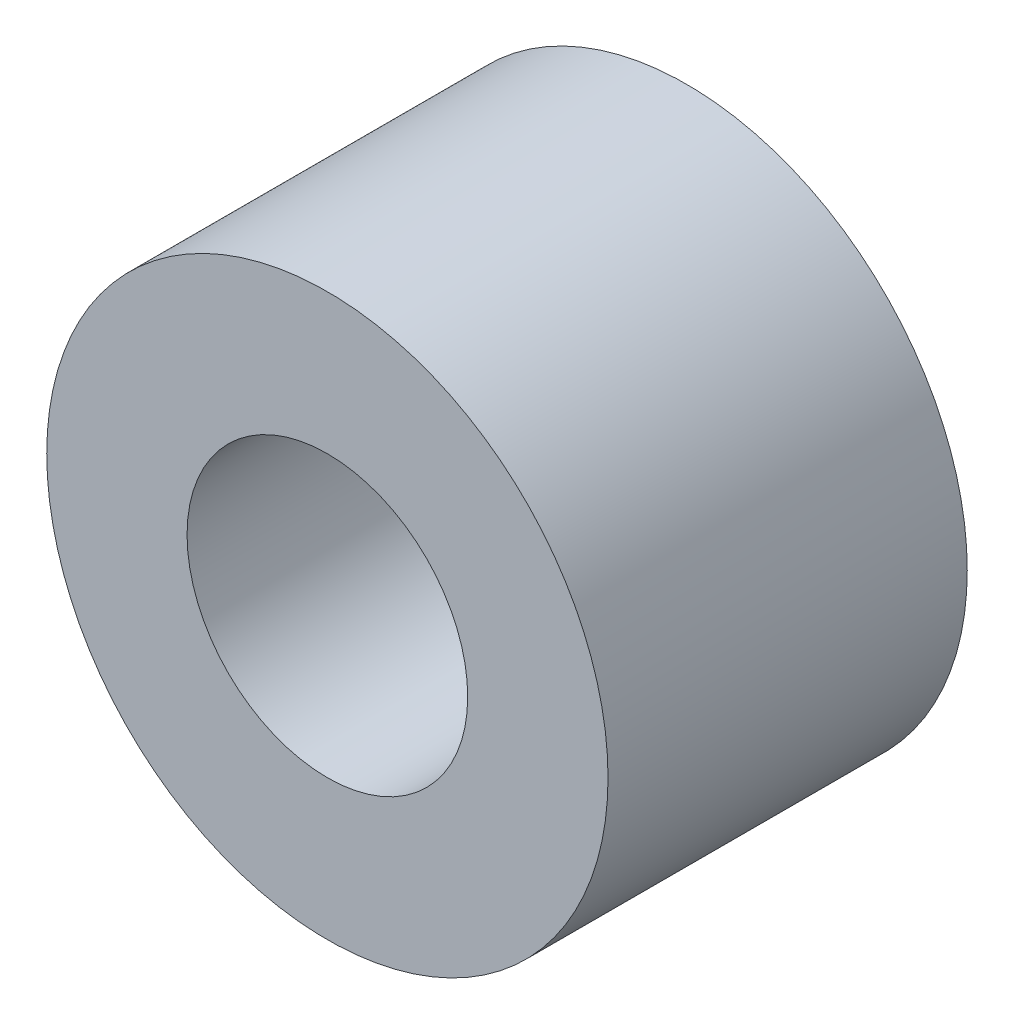
from build123d import *

# Parameters (mm, degrees)
SKETCH1_R           = 6.35
SKETCH1_R_2         = 3.175
BOSS_EXTRUDE1_DEPTH = 8.128


with BuildPart() as part:
    # Sketch1 → Boss-Extrude1 (new body)
    with BuildSketch(Plane.XY):
        Circle(SKETCH1_R)
        Circle(SKETCH1_R_2, mode=Mode.SUBTRACT)
    extrude(amount=BOSS_EXTRUDE1_DEPTH)


solid = part.part
